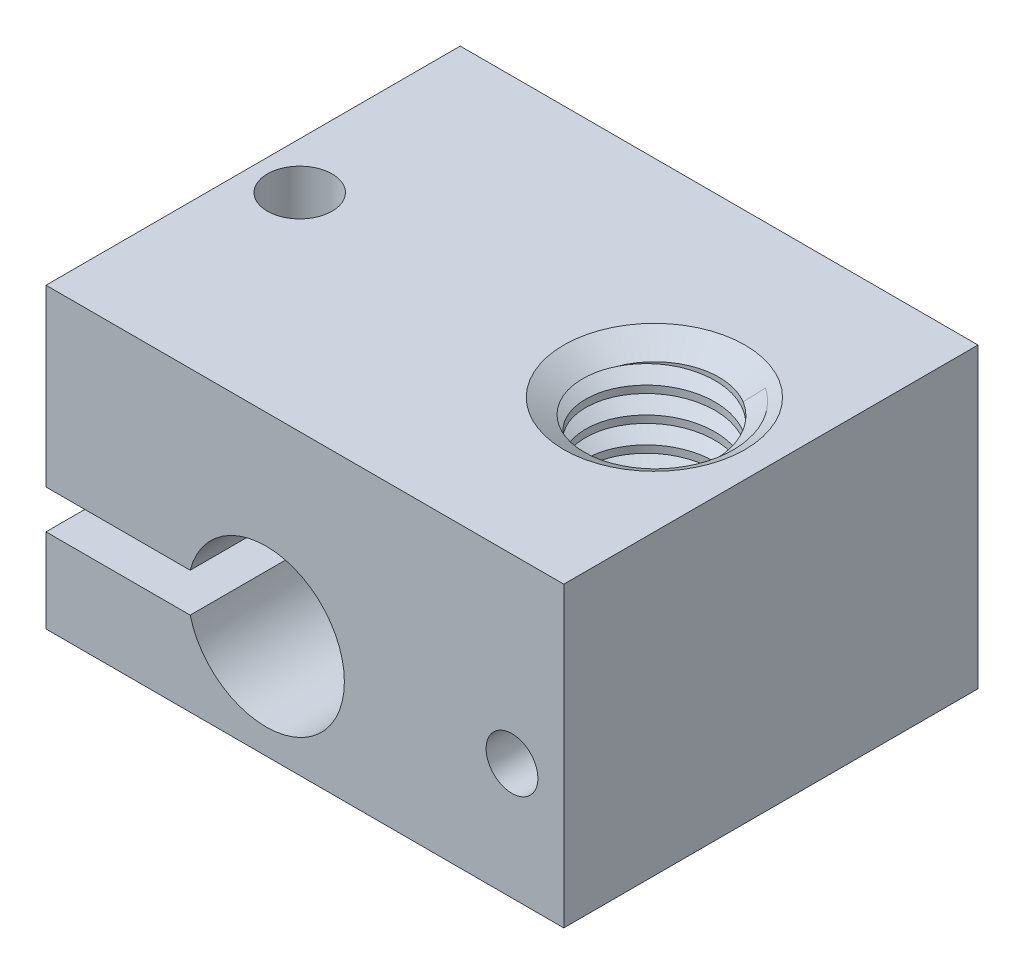
from build123d import *

# Parameters (mm, degrees)
SKETCH1_W           = 20
SKETCH1_H           = 16
BOSS_EXTRUDE1_DEPTH = 5.75
CUT_EXTRUDE1_REACH  = 19.212
SKETCH2_R           = 2.5
SKETCH2_R_2         = 1.25
CUT_EXTRUDE2_REACH  = 21.725
SKETCH4_R           = 1
CUT_EXTRUDE3_DEPTH  = 20.724667298
CHAMFER1_SIZE       = 1
CHAMFER1_SIZE2      = 0.577350269
CUT_SWEEP1_PITCH    = 1


with BuildPart() as part:
    # Sketch1 → Boss-Extrude1 (new, symmetric)
    with BuildSketch(Plane(origin=(0, 0, 0), x_dir=(1, 0, 0), z_dir=(0, 1, 0))):
        Rectangle(SKETCH1_W, SKETCH1_H)
    extrude(amount=BOSS_EXTRUDE1_DEPTH, both=True)

    # Sketch2 → Cut-Extrude1 (cut, up to next)
    with BuildSketch(Plane(origin=(0, 5.75, 0), x_dir=(1, 0, 0), z_dir=(0, 1, 0)), mode=Mode.PRIVATE) as cut_extrude1_sk1:
        with Locations(Location((5.5, 0, 0), (0, 0, 270))):
            Circle(SKETCH2_R)
    cut_extrude1_tool1 = extrude(cut_extrude1_sk1.sketch, amount=-CUT_EXTRUDE1_REACH, mode=Mode.PRIVATE) & part.part
    # Sketch2 → Cut-Extrude1 (cut, up to next)
    with BuildSketch(Plane(origin=(0, 5.75, 0), x_dir=(1, 0, 0), z_dir=(0, 1, 0)), mode=Mode.PRIVATE) as cut_extrude1_sk2:
        with Locations(Location((-8.2, 0, 0), (0, 0, 270))):
            Circle(SKETCH2_R_2)
    cut_extrude1_tool2 = extrude(cut_extrude1_sk2.sketch, amount=-CUT_EXTRUDE1_REACH, mode=Mode.PRIVATE) & part.part
    add(cut_extrude1_tool1.solids().sort_by_distance((5.5, 5.75, 0))[0], mode=Mode.SUBTRACT)
    add(cut_extrude1_tool2.solids().sort_by_distance((-8.2, 5.75, 0))[0], mode=Mode.SUBTRACT)

    # Sketch3 → Cut-Extrude2 (cut, up to next)
    with BuildSketch(Plane.XY.offset(8), mode=Mode.PRIVATE) as cut_extrude2_sk1:
        with BuildLine():
            Line((-15.147501238, -1.75), (-15.147501238, -1))
            Line((-15.147501238, -1), (-4.43055029, -1))
            ThreePointArc((-4.43055029, -1), (1.525, -1.75), (-4.43055029, -2.5))
            Line((-4.43055029, -2.5), (-15.147501238, -2.5))
            Line((-15.147501238, -2.5), (-15.147501238, -1.75))
        make_face()
    cut_extrude2_tool1 = extrude(cut_extrude2_sk1.sketch, amount=-CUT_EXTRUDE2_REACH, mode=Mode.PRIVATE) & part.part
    add(cut_extrude2_tool1.solids().sort_by_distance((-4.472808, -1.75, 8))[0], mode=Mode.SUBTRACT)

    # Sketch4 → Cut-Extrude3 (cut, through all)
    with BuildSketch(Plane.XY.offset(8)):
        with Locations((8, -1.25)):
            Circle(SKETCH4_R)
    extrude(amount=-CUT_EXTRUDE3_DEPTH, mode=Mode.SUBTRACT)

    # Chamfer1
    chamfer1_edges = [part.edges().sort_by_distance(p)[0] for p in [
        (5.5, 5.75, -2.5),
    ]]
    chamfer1_side = [part.faces().sort_by_distance(p)[0] for p in [
        (-0.229274481, 5.75, 0),
    ]]
    chamfer(chamfer1_edges, length=CHAMFER1_SIZE, length2=CHAMFER1_SIZE2, reference=chamfer1_side[0])

    # Cut-Sweep1: the profile of Sketch7 screwed along a right-hand helix of 20 turns, 8 arcs to a turn; built about Z, then put on its axis
    cut_sweep1_z = Axis((0, 0, 0), (0, 0, 1))
    cut_sweep1_corners = [(-2.208234359, 2.208234359, 2.380783477), (-1.589738199, 1.589738199, 1.875783477), (-1.589738199, 1.589738199, 2.885783477)]
    with BuildLine(mode=Mode.PRIVATE) as cut_sweep1_profile:
        Line(cut_sweep1_corners[0], cut_sweep1_corners[1])
        Line(cut_sweep1_corners[1], cut_sweep1_corners[2])
        Line(cut_sweep1_corners[2], cut_sweep1_corners[0])
    cut_sweep1_cap = Face(cut_sweep1_profile.wire())
    cut_sweep1_turn_angles = [0, 22.5, 45, 67.5, 90, 112.5, 135, 157.5, 180, 202.5, 225, 247.5, 270, 292.5, 315, 337.5, 360]
    cut_sweep1_turn_weights = [1, 0.9238795325112867, 1, 0.9238795325112867, 1, 0.9238795325112867, 1, 0.9238795325112867, 1, 0.9238795325112867, 1, 0.9238795325112867, 1, 0.9238795325112867, 1, 0.9238795325112867, 1]
    cut_sweep1_turn_rails = [Edge.make_bspline([Vector(p[0], p[1], 0).rotate(cut_sweep1_z, cut_sweep1_turn_angles[k]) / cut_sweep1_turn_weights[k] + Vector(0, 0, p[2] + CUT_SWEEP1_PITCH * cut_sweep1_turn_angles[k] / 360) for k in range(17)], [0, 0, 0, 1, 1, 2, 2, 3, 3, 4, 4, 5, 5, 6, 6, 7, 7, 8, 8, 8], 2, cut_sweep1_turn_weights) for p in cut_sweep1_corners]
    cut_sweep1_turn_sides = [Face.make_surface_from_curves(cut_sweep1_turn_rails[p[0]], cut_sweep1_turn_rails[p[1]]) for p in [(0, 1), (1, 2), (2, 0)]]
    cut_sweep1 = Plane(origin=(5.5, 8.75, 0), x_dir=(-0.7071067811865537, 0, -0.7071067811865414), z_dir=(0, -1, 0)) * Solid(Shell([*[p.moved(Location((0, 0, CUT_SWEEP1_PITCH * i))) for i in range(20) for p in cut_sweep1_turn_sides], cut_sweep1_cap, cut_sweep1_cap.rotate(cut_sweep1_z, 7200).moved(Location((0, 0, CUT_SWEEP1_PITCH * 7200 / 360)))]))
    add(cut_sweep1, mode=Mode.SUBTRACT)


solid = part.part
